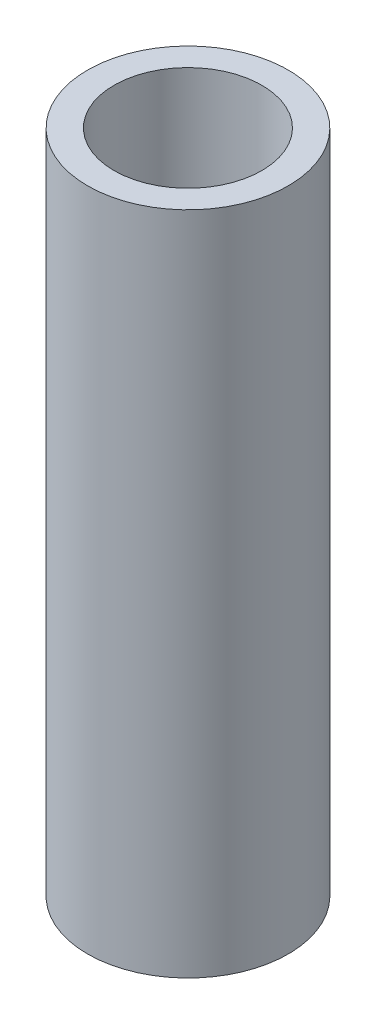
from build123d import *

# Parameters (mm, degrees)
BOSS_EXTRUDE1_DEPTH      = 6
BOSS_EXTRUDE1_DEPTH_BACK = 2
SKETCH1_R                = 1.2065
SKETCH1_R_2              = 0.889


with BuildPart() as part:
    # Sketch1 → Boss-Extrude1 (new, two sides: drawn at the far end of the back side and taken through both)
    with BuildSketch(Plane(origin=(0, 0, 0), x_dir=(1, 0, 0), z_dir=(0, 1, 0)).offset(-BOSS_EXTRUDE1_DEPTH_BACK)):
        Circle(SKETCH1_R)
        Circle(SKETCH1_R_2, mode=Mode.SUBTRACT)
    extrude(amount=BOSS_EXTRUDE1_DEPTH + BOSS_EXTRUDE1_DEPTH_BACK)


solid = part.part
